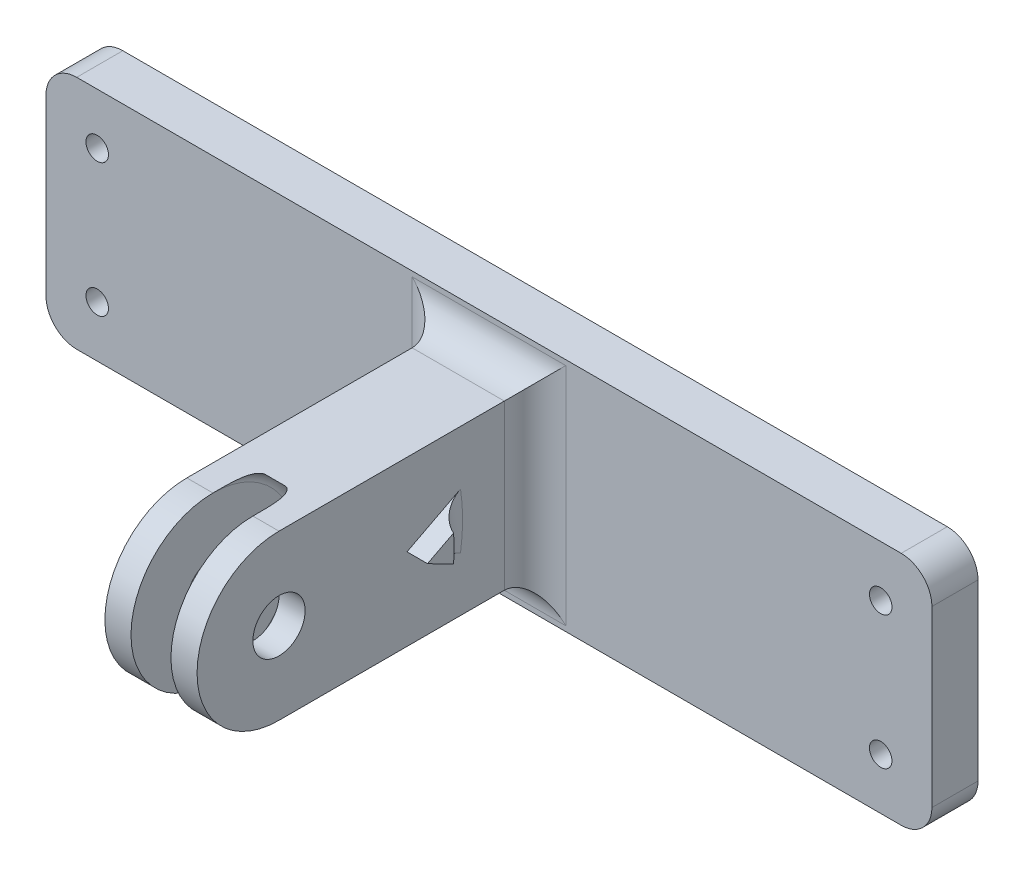
from build123d import *

# Parameters (mm, degrees)
SKETCH1_W           = 86.5
SKETCH1_H           = 23
SKETCH1_R           = 1.1
BOSS_EXTRUDE1_DEPTH = 4.5
CUT_EXTRUDE1_DEPTH  = 2
SKETCH3_R           = 2.55
BOSS_EXTRUDE2_DEPTH = 4.5
SKETCH6_R           = 9
CUT_EXTRUDE3_DEPTH  = 1.95
FILLET1_R           = 3
FILLET2_R           = 1
FILLET3_R           = 1
BOSS_EXTRUDE3_DEPTH = 2
FILLET4_R           = 3


with BuildPart() as part:
    # Sketch1 → Boss-Extrude1 (new body)
    with BuildSketch(Plane.XY):
        Rectangle(SKETCH1_W, SKETCH1_H)
        with Locations((38.25, 6.5)):
            Circle(SKETCH1_R, mode=Mode.SUBTRACT)
        with Locations((38.25, -6.5)):
            Circle(SKETCH1_R, mode=Mode.SUBTRACT)
        with Locations((-38.25, -6.5)):
            Circle(SKETCH1_R, mode=Mode.SUBTRACT)
        with Locations((-38.25, 6.5)):
            Circle(SKETCH1_R, mode=Mode.SUBTRACT)
    extrude(amount=BOSS_EXTRUDE1_DEPTH)

    # Sketch2 → Cut-Extrude1 (cut)
    with BuildSketch(Plane(origin=(0, 0, 0), x_dir=(-1, 0, 0), z_dir=(0, 0, -1))):
        with BuildLine():
            Line((-5, 9.5), (-35.604248689, 9.5))
            ThreePointArc((-35.604248689, 9.5), (-34.508342613, 5.085786438), (-38.25, 2.5))
            Line((-38.25, 2.5), (-38.25, -2.5))
            ThreePointArc((-38.25, -2.5), (-34.508342613, -5.085786438), (-35.604248689, -9.5))
            Line((-35.604248689, -9.5), (-5, -9.5))
            Line((-5, -9.5), (-5, 9.5))
        make_face()
        with BuildLine():
            Line((35.604248689, 9.5), (5, 9.5))
            Line((5, 9.5), (5, -9.5))
            Line((5, -9.5), (35.604248689, -9.5))
            ThreePointArc((35.604248689, -9.5), (34.508342613, -5.085786438), (38.25, -2.5))
            Line((38.25, -2.5), (38.25, 2.5))
            ThreePointArc((38.25, 2.5), (34.508342613, 5.085786438), (35.604248689, 9.5))
        make_face()
    extrude(amount=-CUT_EXTRUDE1_DEPTH, mode=Mode.SUBTRACT)

    # Sketch3 → Boss-Extrude2 (add, symmetric)
    with BuildSketch(Plane(origin=(0, 0, 0), x_dir=(0, 0, -1), z_dir=(1, 0, 0))):
        with BuildLine():
            Line((-29.5, 8), (-4.5, 8))
            Line((-4.5, 8), (-4.5, -8))
            Line((-4.5, -8), (-29.5, -8))
            ThreePointArc((-29.5, -8), (-37.5, 0), (-29.5, 8))
        make_face()
        with Locations((-29.5, 0)):
            Circle(SKETCH3_R, mode=Mode.SUBTRACT)
    extrude(amount=BOSS_EXTRUDE2_DEPTH, both=True)

    # Sketch6 → Cut-Extrude3 (cut, symmetric)
    with BuildSketch(Plane(origin=(0, 0, 0), x_dir=(0, 0, -1), z_dir=(1, 0, 0))):
        with Locations((-29.5, 0)):
            Circle(SKETCH6_R)
    extrude(amount=CUT_EXTRUDE3_DEPTH, both=True, mode=Mode.SUBTRACT)

    # Fillet1
    fillet1_edges = [part.edges().sort_by_distance(p)[0] for p in [
        (4.5, 0, 4.5),
        (-4.5, 0, 4.5),
        (0, -8, 4.5),
        (0, 8, 4.5),
        (43.25, -11.5, 2.25),
        (-43.25, -11.5, 2.25),
        (-43.25, 11.5, 2.25),
        (43.25, 11.5, 2.25),
    ]]
    fillet(fillet1_edges, radius=FILLET1_R)

    # Fillet2
    fillet2_edges = [part.edges().sort_by_distance(p)[0] for p in [
        (1.95, 0, 20.5),
        (-1.95, 0, 20.5),
    ]]
    fillet(fillet2_edges, radius=FILLET2_R)

    # Fillet3
    fillet3_edges = [part.edges().sort_by_distance(p)[0] for p in [
        (35.604248689, -9.5, 1),
        (38.25, -2.5, 1),
        (38.25, 2.5, 1),
        (35.604248689, 9.5, 1),
        (5, 9.5, 1),
        (5, -9.5, 1),
        (-35.604248689, -9.5, 1),
        (-5, -9.5, 1),
        (-5, 9.5, 1),
        (-35.604248689, 9.5, 1),
        (-38.25, 2.5, 1),
        (-38.25, -2.5, 1),
    ]]
    fillet(fillet3_edges, radius=FILLET3_R)

    # Sketch7 → Boss-Extrude3 (add)
    with BuildSketch(Plane(origin=(4.5, 0, 0), x_dir=(0, 0, -1), z_dir=(1, 0, 0))):
        Polygon((-14.457460059, 1.316051715), (-17, 0), (-14.457460059, 0), align=None)
        Polygon((-14.457460059, 0), (-17, 0), (-14.457460059, -1.316051715), align=None)
        with BuildLine():
            Line((-14.457460059, 0), (-14.457460059, -1.316051715))
            ThreePointArc((-14.457460059, -1.316051715), (-14.414371854, -0.658652749), (-14.4, 0))
            Line((-14.4, 0), (-14.457460059, 0))
        make_face()
        with BuildLine():
            ThreePointArc((-14.4, 0), (-14.414371854, 0.658652749), (-14.457460059, 1.316051715))
            Line((-14.457460059, 1.316051715), (-14.457460059, 0))
            Line((-14.457460059, 0), (-14.4, 0))
        make_face()
    boss_extrude3 = extrude(amount=BOSS_EXTRUDE3_DEPTH)

    # Mirror1: Boss-Extrude3 across plane
    add(boss_extrude3.mirror(Plane(origin=(0, 0, 0), x_dir=(0, 0, 1), z_dir=(1, 0, 0))))

    # Fillet4
    # the kernel refuses this fillet: 3 mm, written as the material it adds along each edge
    with BuildSketch(Plane(origin=(4.5, 0, 29.5), x_dir=(0, -0.5274118729194984, -0.8496097435314327), z_dir=(0, -0.8496097435314327, 0.5274118729194984))) as fillet4_piece_1_section:
        with BuildLine():
            CenterArc((17.928427125, 3), FILLET4_R, 199.471220634, 70.528779366)
            Line((15.1, 2), (15.043431458, 1.98))
            ThreePointArc((15.043431458, 1.98), (15.04, 1), (15.04, 0))
            Line((15.04, 0), (15.1, -0.06))
            Line((15.1, -0.06), (17.928427125, -0.06))
            Line((17.928427125, -0.06), (17.928427125, 0))
        make_face()
    fillet4_piece_1 = revolve(axis=Axis((4.5, 0, 29.5), (1, 0, 0)), revolution_arc=63.661503438, mode=Mode.PRIVATE)
    fillet4_piece_1 = split(fillet4_piece_1, bisect_by=Plane(origin=(4.961847774, -1.372551705, 14.348305169), z_dir=(0, 0.888082932047281, -0.4596832668330496)), keep=Keep.TOP, mode=Mode.PRIVATE)
    fillet4_piece_1 = split(fillet4_piece_1, bisect_by=Plane(origin=(4.961847774, 1.372551598, 14.348305377), z_dir=(0, -0.8880829320471848, -0.4596832668332354)), keep=Keep.TOP, mode=Mode.PRIVATE)
    add(fillet4_piece_1)
    with BuildSketch(Plane(origin=(-4.5, 0, 29.5), x_dir=(0, -0.5274118729194984, -0.8496097435314327), z_dir=(0, -0.8496097435314327, 0.5274118729194984))) as fillet4_piece_2_section:
        with BuildLine():
            CenterArc((17.928427125, -3), FILLET4_R, 90, 70.528779366)
            Line((15.1, -2), (15.043431458, -1.98))
            ThreePointArc((15.043431458, -1.98), (15.04, -1), (15.04, 0))
            Line((15.04, 0), (15.1, 0.06))
            Line((15.1, 0.06), (17.928427125, 0.06))
            Line((17.928427125, 0.06), (17.928427125, 0))
        make_face()
    fillet4_piece_2 = revolve(axis=Axis((-4.5, 0, 29.5), (1, 0, 0)), revolution_arc=63.661503438, mode=Mode.PRIVATE)
    fillet4_piece_2 = split(fillet4_piece_2, bisect_by=Plane(origin=(-4.961847774, -1.372551705, 14.348305169), z_dir=(0, 0.888082932047281, -0.4596832668330496)), keep=Keep.TOP, mode=Mode.PRIVATE)
    fillet4_piece_2 = split(fillet4_piece_2, bisect_by=Plane(origin=(-4.961847774, 1.372551598, 14.348305377), z_dir=(0, -0.8880829320471848, -0.4596832668332354)), keep=Keep.TOP, mode=Mode.PRIVATE)
    add(fillet4_piece_2)


solid = part.part
